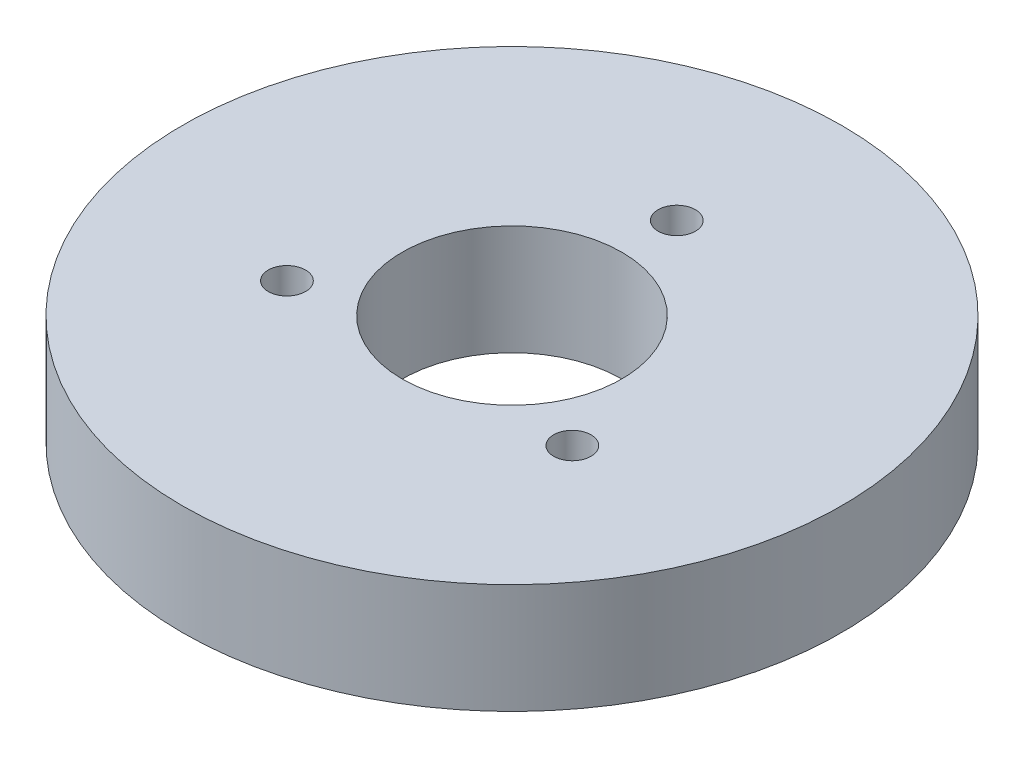
from build123d import *

# Parameters (mm, degrees)
SKETCH1_R            = 30
SKETCH1_R_2          = 10
BOSS_EXTRUDE1_DEPTH  = 10
M3_CLEARANCE_HOLE1_D = 3.4


with BuildPart() as part:
    # Sketch1 → Boss-Extrude1 (new body)
    with BuildSketch(Plane(origin=(0, 0, 0), x_dir=(1, 0, 0), z_dir=(0, 1, 0))):
        Circle(SKETCH1_R)
        Circle(SKETCH1_R_2, mode=Mode.SUBTRACT)
    extrude(amount=BOSS_EXTRUDE1_DEPTH)

    # M3 Clearance Hole1 (through all)
    with Locations(Plane(origin=(0, 10, 0), x_dir=(1, 0, 0), z_dir=(0, 1, 0))):
        with Locations((0, 15), (12.991881057, -7.499133975), (-12.988881057, -7.500866025), (0.001, 0)):
            Hole(M3_CLEARANCE_HOLE1_D / 2)


solid = part.part
